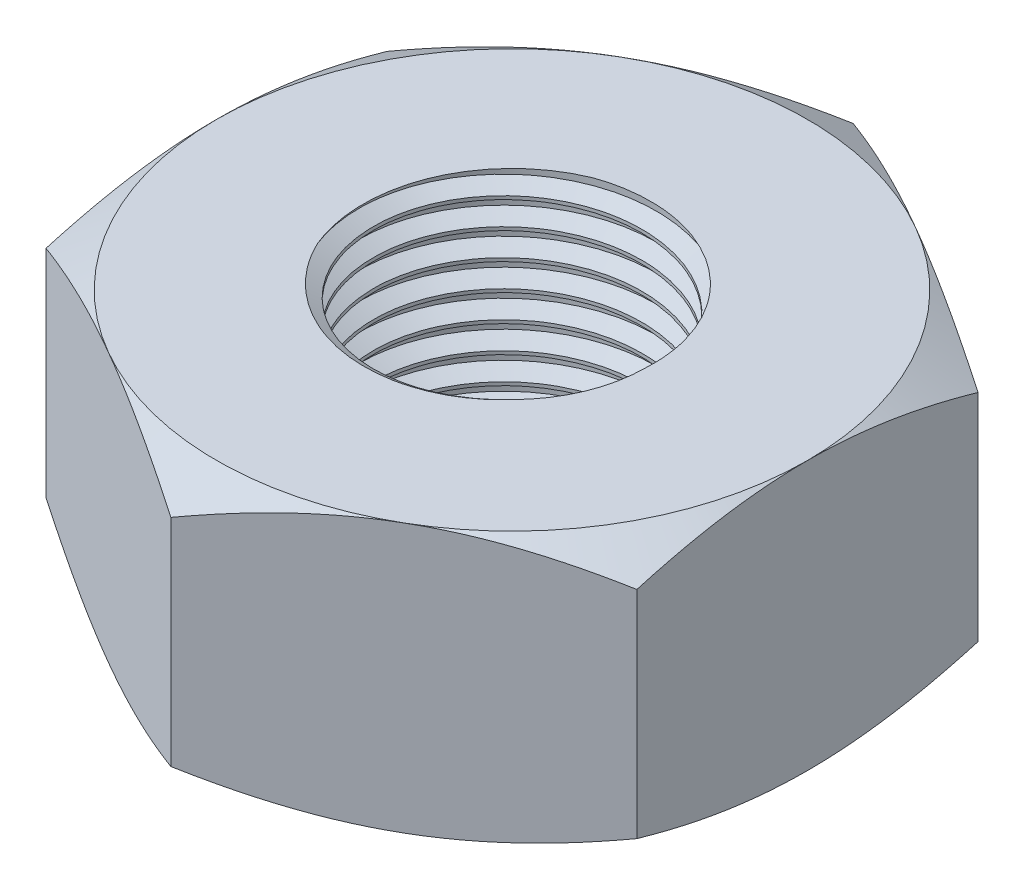
from build123d import *

# Parameters (mm, degrees)
BOSS_EXTRUDE1_DEPTH     = 10
M22X2_0_TAPPED_HOLE1_D  = 20
THREAD1_PITCH           = 2
SKETCH7_OUTSIDE_W       = 198.958
SKETCH7_OUTSIDE_H       = 205.764
SKETCH7_OUTSIDE_R       = 22
CUT_EXTRUDE1_DEPTH      = 40.106691842
CUT_EXTRUDE1_DRAFT      = -60
MIRROR1_COPY_1_SKETCH_W = 198.958
MIRROR1_COPY_1_SKETCH_H = 205.764
MIRROR1_COPY_1_SKETCH_R = 22
MIRROR1_COPY_1_DEPTH    = 40.106691842
MIRROR1_COPY_1_DRAFT    = -60


with BuildPart() as part:
    # Sketch1 → Boss-Extrude1 (new, symmetric)
    with BuildSketch(Plane(origin=(0, 0, 0), x_dir=(1, 0, 0), z_dir=(0, 1, 0))):
        Polygon((0, 25.403411844), (-22, 12.701705922), (-22, -12.701705922), (0, -25.403411844), (22, -12.701705922), (22, 12.701705922), align=None)
    extrude(amount=BOSS_EXTRUDE1_DEPTH, both=True)

    # M22x2.0 Tapped Hole1 (through all)
    with Locations(Plane(origin=(0, 10, 0), x_dir=(1, 0, 0), z_dir=(0, 1, 0))):
        with Locations((0, 0)):
            Hole(M22X2_0_TAPPED_HOLE1_D / 2)

    # Thread1: the profile of Thread Profile1 profile screwed along a right-hand helix of 20 turns, 10 arcs to a turn; built about Z, then put on its axis
    thread1_z = Axis((0, 0, 0), (0, 0, 1))
    thread1_corners = [(9.9997, 0, -0.000173205), (9.9997, 0, 1.7501732), (11.08253175, 0, 1.124999997), (11.08253175, 0, 0.624999997)]
    with BuildLine(mode=Mode.PRIVATE) as thread1_profile:
        Line(thread1_corners[0], thread1_corners[1])
        Line(thread1_corners[1], thread1_corners[2])
        Line(thread1_corners[2], thread1_corners[3])
        Line(thread1_corners[3], thread1_corners[0])
    thread1_cap = Face(thread1_profile.wire())
    thread1_turn_angles = [0, 18, 36, 54, 72, 90, 108, 126, 144, 162, 180, 198, 216, 234, 252, 270, 288, 306, 324, 342, 360]
    thread1_turn_weights = [1, 0.9510565162951535, 1, 0.9510565162951535, 1, 0.9510565162951535, 1, 0.9510565162951535, 1, 0.9510565162951535, 1, 0.9510565162951535, 1, 0.9510565162951535, 1, 0.9510565162951535, 1, 0.9510565162951535, 1, 0.9510565162951535, 1]
    thread1_turn_rails = [Edge.make_bspline([Vector(p[0], p[1], 0).rotate(thread1_z, thread1_turn_angles[k]) / thread1_turn_weights[k] + Vector(0, 0, p[2] + THREAD1_PITCH * thread1_turn_angles[k] / 360) for k in range(21)], [0, 0, 0, 1, 1, 2, 2, 3, 3, 4, 4, 5, 5, 6, 6, 7, 7, 8, 8, 9, 9, 10, 10, 10], 2, thread1_turn_weights) for p in thread1_corners]
    thread1_turn_sides = [Face.make_surface_from_curves(thread1_turn_rails[p[0]], thread1_turn_rails[p[1]]) for p in [(0, 1), (1, 2), (2, 3), (3, 0)]]
    thread1 = Plane(origin=(0, 15, 0), x_dir=(-1, 0, 0), z_dir=(0, -1, 0)) * Solid(Shell([*[p.moved(Location((0, 0, THREAD1_PITCH * i))) for i in range(20) for p in thread1_turn_sides], thread1_cap, thread1_cap.rotate(thread1_z, 7200).moved(Location((0, 0, THREAD1_PITCH * 7200 / 360)))]))
    add(thread1, mode=Mode.SUBTRACT)


with BuildPart() as cut_extrude1_tool:
    # Sketch7 outside → Cut-Extrude1 (with draft: the straight prism first)
    with BuildSketch(Plane(origin=(0, 10, 0), x_dir=(1, 0, 0), z_dir=(0, 1, 0))):
        Rectangle(SKETCH7_OUTSIDE_W, SKETCH7_OUTSIDE_H)
        Circle(SKETCH7_OUTSIDE_R, mode=Mode.SUBTRACT)
    extrude(amount=-CUT_EXTRUDE1_DEPTH)
    # Cut-Extrude1: the draft: its side faces are tilted about the plane it starts from
    cut_extrude1_sides = [cut_extrude1_tool.faces().sort_by_distance(p)[0] for p in [
        (0, -10.053345921, 102.882),
        (99.479, -10.053345921, 0),
        (0, -10.053345921, -102.882),
        (-99.479, -10.053345921, 0),
        (-22, -10.053345921, 0),
    ]]
    draft(cut_extrude1_sides, Plane(origin=(0, 10, 0), x_dir=(1, 0, 0), z_dir=(0, 1, 0)), CUT_EXTRUDE1_DRAFT)


with BuildPart() as part_1:
    add(part.part)

    # Cut-Extrude1: cut by cut_extrude1_tool
    add(cut_extrude1_tool.part, mode=Mode.SUBTRACT)


with BuildPart() as mirror1_copy_1_tool:
    # Mirror1 copy 1 sketch → Mirror1 copy 1 (with draft: the straight prism first)
    with BuildSketch(Plane.XZ.offset(10)):
        Rectangle(MIRROR1_COPY_1_SKETCH_W, MIRROR1_COPY_1_SKETCH_H)
        Circle(MIRROR1_COPY_1_SKETCH_R, mode=Mode.SUBTRACT)
    extrude(amount=-MIRROR1_COPY_1_DEPTH)
    # Mirror1 copy 1: the draft: its side faces are tilted about the plane it starts from
    mirror1_copy_1_sides = [mirror1_copy_1_tool.faces().sort_by_distance(p)[0] for p in [
        (0, 10.053345921, 102.882),
        (99.479, 10.053345921, 0),
        (0, 10.053345921, -102.882),
        (-99.479, 10.053345921, 0),
        (-22, 10.053345921, 0),
    ]]
    draft(mirror1_copy_1_sides, Plane.XZ.offset(10), MIRROR1_COPY_1_DRAFT)


with BuildPart() as part_2:
    add(part_1.part)

    # Mirror1 copy 1: cut by mirror1_copy_1_tool
    add(mirror1_copy_1_tool.part, mode=Mode.SUBTRACT)


solid = part_2.part
